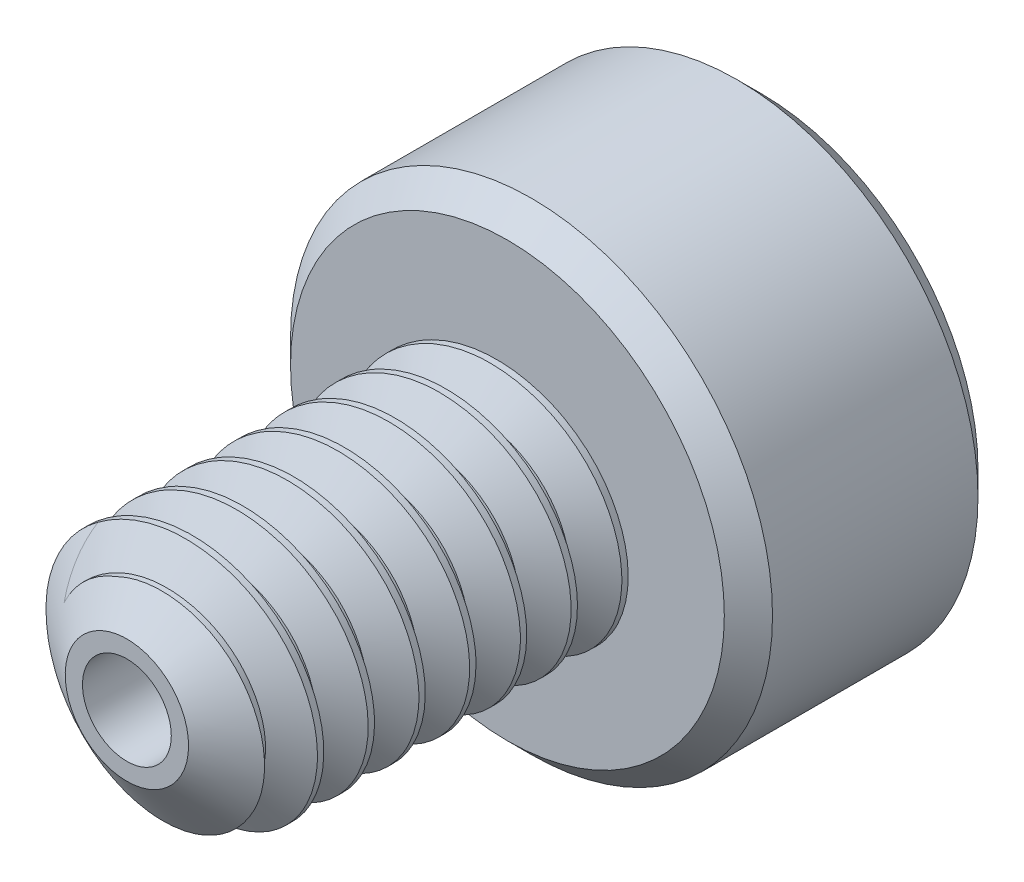
from build123d import *

# Parameters (mm, degrees)
SKETCH1_R          = 1
EXTRUDE1_DEPTH     = 3
CUT_SWEEP1_PITCH   = 0.4
SKETCH6_R          = 1.9
EXTRUDE2_DEPTH     = 2
CUT_EXTRUDE1_DEPTH = 1.125
CHAMFER1_SIZE      = 0.19
SKETCH11_R         = 0.35
CUT_EXTRUDE3_DEPTH = 6.676266379


with BuildPart() as part:
    # Sketch1 → Extrude1 (new body)
    with BuildSketch(Plane.XY):
        Circle(SKETCH1_R)
    extrude(amount=-EXTRUDE1_DEPTH)

    # Cut-Sweep1: the profile of Sketch3 profile screwed along a right-hand helix of 8.5 turns, 6 arcs to a turn; built about Z, then put on its axis
    cut_sweep1_z = Axis((0, 0, 0), (0, 0, 1))
    cut_sweep1_corners = [(1.0003, 0, -0.350173205), (0.740192379, 0, -0.2), (0.740192379, 0, -0.15), (1.0003, 0, 0.000173205)]
    with BuildLine(mode=Mode.PRIVATE) as cut_sweep1_profile:
        Line(cut_sweep1_corners[0], cut_sweep1_corners[1])
        Line(cut_sweep1_corners[1], cut_sweep1_corners[2])
        Line(cut_sweep1_corners[2], cut_sweep1_corners[3])
        Line(cut_sweep1_corners[3], cut_sweep1_corners[0])
    cut_sweep1_cap = Face(cut_sweep1_profile.wire())
    cut_sweep1_turn_angles = [0, 30, 60, 90, 120, 150, 180, 210, 240, 270, 300, 330, 360]
    cut_sweep1_turn_weights = [1, 0.8660254037844387, 1, 0.8660254037844387, 1, 0.8660254037844387, 1, 0.8660254037844387, 1, 0.8660254037844387, 1, 0.8660254037844387, 1]
    cut_sweep1_turn_rails = [Edge.make_bspline([Vector(p[0], p[1], 0).rotate(cut_sweep1_z, cut_sweep1_turn_angles[k]) / cut_sweep1_turn_weights[k] + Vector(0, 0, p[2] + CUT_SWEEP1_PITCH * cut_sweep1_turn_angles[k] / 360) for k in range(13)], [0, 0, 0, 1, 1, 2, 2, 3, 3, 4, 4, 5, 5, 6, 6, 6], 2, cut_sweep1_turn_weights) for p in cut_sweep1_corners]
    cut_sweep1_turn_sides = [Face.make_surface_from_curves(cut_sweep1_turn_rails[p[0]], cut_sweep1_turn_rails[p[1]]) for p in [(0, 1), (1, 2), (2, 3), (3, 0)]]
    cut_sweep1_last_angles = [2880, 2910, 2940, 2970, 3000, 3030, 3060]
    cut_sweep1_last_weights = [1, 0.8660254037844387, 1, 0.8660254037844387, 1, 0.8660254037844327, 1]
    cut_sweep1_last_rails = [Edge.make_bspline([Vector(p[0], p[1], 0).rotate(cut_sweep1_z, cut_sweep1_last_angles[k]) / cut_sweep1_last_weights[k] + Vector(0, 0, p[2] + CUT_SWEEP1_PITCH * cut_sweep1_last_angles[k] / 360) for k in range(7)], [0, 0, 0, 1, 1, 2, 2, 3, 3, 3], 2, cut_sweep1_last_weights) for p in cut_sweep1_corners]
    cut_sweep1_last_sides = [Face.make_surface_from_curves(cut_sweep1_last_rails[p[0]], cut_sweep1_last_rails[p[1]]) for p in [(0, 1), (1, 2), (2, 3), (3, 0)]]
    cut_sweep1 = Plane(origin=(0, 0, 0), x_dir=(0, 1, 0), z_dir=(0, 0, -1)) * Solid(Shell([*[p.moved(Location((0, 0, CUT_SWEEP1_PITCH * i))) for i in range(8) for p in cut_sweep1_turn_sides], *cut_sweep1_last_sides, cut_sweep1_cap, cut_sweep1_cap.rotate(cut_sweep1_z, 3060).moved(Location((0, 0, CUT_SWEEP1_PITCH * 3060 / 360)))]))
    add(cut_sweep1, mode=Mode.SUBTRACT)

    # Sketch4 → Cut-Revolve1 (revolve, cut)
    with BuildSketch(Plane(origin=(0, 0, 0), x_dir=(0, 0, -1), z_dir=(1, 0, 0)), mode=Mode.PRIVATE) as cut_revolve1_sk:
        Polygon((0.35977197, 1), (0, 0.486192379), (0, 1), align=None)
    revolve(cut_revolve1_sk.sketch.rotate(Axis((0, 0, 0), (0, 0, -1)), 278.428757719), axis=Axis((0, 0, 0), (0, 0, -1)), mode=Mode.SUBTRACT)

    # Sketch6 → Extrude2 (add)
    with BuildSketch(Plane(origin=(0, 0, -3), x_dir=(-1, 0, 0), z_dir=(0, 0, -1))):
        Circle(SKETCH6_R)
    extrude(amount=EXTRUDE2_DEPTH)

    # Sketch7 → Cut-Extrude1 (cut)
    with BuildSketch(Plane(origin=(0, 0, -5), x_dir=(-1, 0, 0), z_dir=(0, 0, -1))):
        Polygon((0, 0.866025404), (-0.75, 0.433012702), (-0.75, -0.433012702), (0, -0.866025404), (0.75, -0.433012702), (0.75, 0.433012702), align=None)
    extrude(amount=-CUT_EXTRUDE1_DEPTH, mode=Mode.SUBTRACT)

    # Cut-Extrude2 cone 1 section (through the dimple's axis) → Cut-Extrude2 (revolve, cut)
    with BuildSketch(Plane(origin=(0, 0, -5), x_dir=(0, 1, 0), z_dir=(1, 0, 0))):
        Polygon((0, 0), (0.866025404, 0), (0, 0.866025404), align=None)
    revolve(axis=Axis((0, 0, -5), (0, 0, 1)), mode=Mode.SUBTRACT)

    # Chamfer1
    chamfer1_edges = [part.edges().sort_by_distance(p)[0] for p in [
        (1.9, 0, -3),
        (1.9, 0, -5),
    ]]
    chamfer(chamfer1_edges, length=CHAMFER1_SIZE)

    # Sketch11 → Cut-Extrude3 (cut, through all)
    with BuildSketch(Plane.XY):
        Circle(SKETCH11_R)
    extrude(amount=-CUT_EXTRUDE3_DEPTH, mode=Mode.SUBTRACT)


solid = part.part
